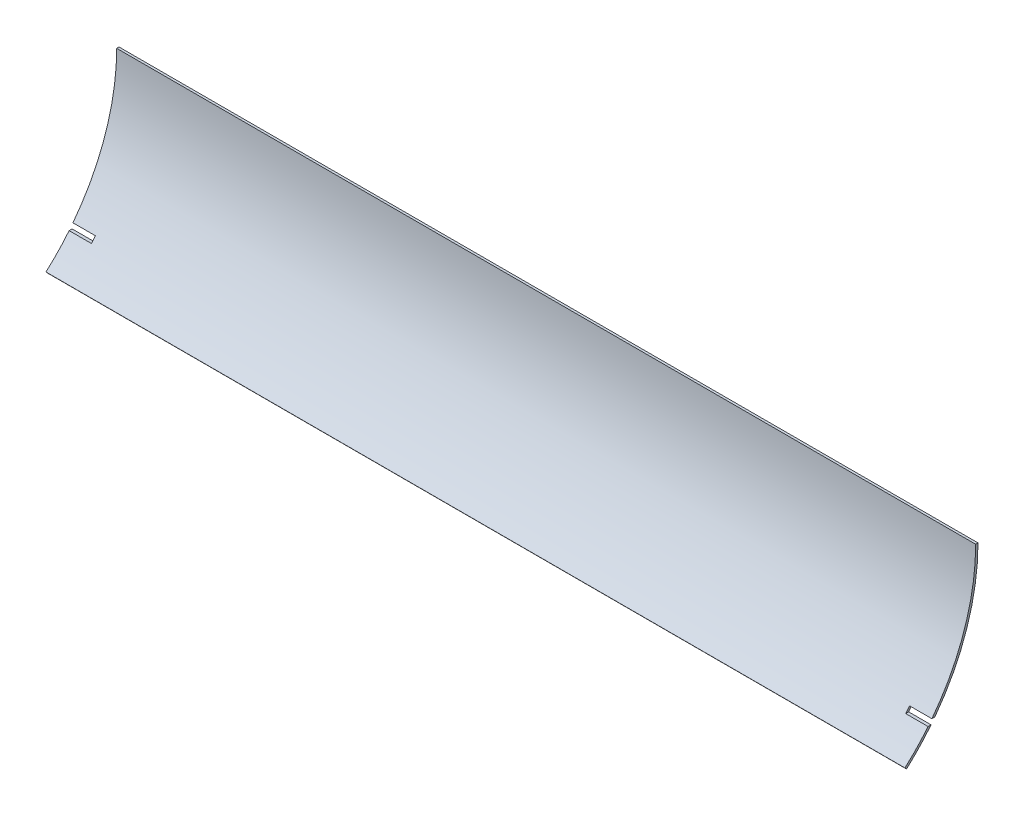
from build123d import *

# Parameters (mm, degrees)
EXTRUDE_THIN1_DEPTH = 584.2
SKETCH3_W           = 15.24
SKETCH3_H           = 3.302
CUT_EXTRUDE1_DEPTH  = 612.981408168


with BuildPart() as part:
    # Sketch2 → Extrude-Thin1 (new body)
    with BuildSketch(Plane(origin=(0, 0, 0), x_dir=(0, 0, -1), z_dir=(1, 0, 0))):
        with BuildLine():
            ThreePointArc((97.582750573, -108.878856383), (133.499907414, -59.621919601), (146.20875, 0))
            Line((146.20875, 0), (144.62125, 0))
            ThreePointArc((144.62125, 0), (132.050397019, -58.97455891), (96.523220165, -107.696675532))
            Line((96.523220165, -107.696675532), (97.582750573, -108.878856383))
        make_face()
    extrude(amount=EXTRUDE_THIN1_DEPTH)

    # Sketch3 → Cut-Extrude1 (cut, through all)
    with BuildSketch(Plane.XY):
        with Locations((7.62, -89.535675532)):
            Rectangle(SKETCH3_W, SKETCH3_H)
        with Locations((576.58, -89.535675532)):
            Rectangle(SKETCH3_W, SKETCH3_H)
    extrude(amount=-CUT_EXTRUDE1_DEPTH, mode=Mode.SUBTRACT)


solid = part.part
